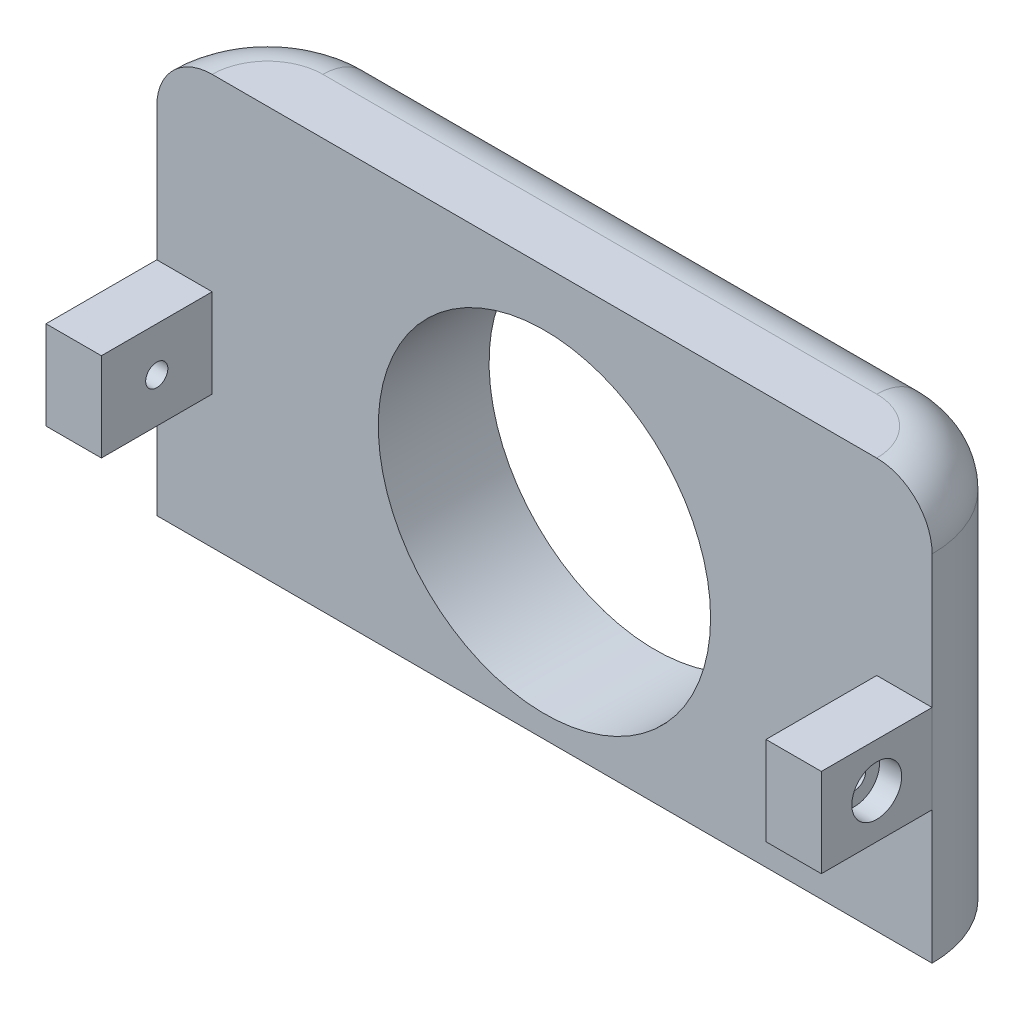
from build123d import *

# Parameters (mm, degrees)
BOSS_EXTRUDE1_DEPTH = 37
CUT_EXTRUDE1_REACH  = 53.904
FILLET1_R           = 5
CUT_EXTRUDE2_REACH  = 53.904
SKETCH4_R           = 15
SKETCH5_W           = 10
SKETCH5_H           = 8
SKETCH5_R           = 2.25
SKETCH5_R_2         = 1
BOSS_EXTRUDE2_DEPTH = 5
SKETCH5_3_R         = 2.25
SKETCH5_3_R_2       = 1
CUT_EXTRUDE3_DEPTH  = 2


with BuildPart() as part:
    # Sketch1 → Boss-Extrude1 (new body)
    with BuildSketch(Plane(origin=(0, 0, 0), x_dir=(1, 0, 0), z_dir=(0, 1, 0))):
        with BuildLine():
            Line((-25, 0), (25, 0))
            ThreePointArc((25, 0), (32.071067812, -2.928932188), (35, -10))
            Line((35, -10), (-35, -10))
            ThreePointArc((-35, -10), (-32.071067812, -2.928932188), (-25, 0))
        make_face()
    extrude(amount=BOSS_EXTRUDE1_DEPTH)

    # Sketch3 → Cut-Extrude1 (cut, up to next)
    with BuildSketch(Plane.XY.offset(10), mode=Mode.PRIVATE) as cut_extrude1_sk1:
        with BuildLine():
            Line((-30, 37), (-35, 37))
            Line((-35, 37), (-35, 32))
            ThreePointArc((-35, 32), (-33.535533906, 35.535533906), (-30, 37))
        make_face()
    cut_extrude1_tool1 = extrude(cut_extrude1_sk1.sketch, amount=-CUT_EXTRUDE1_REACH, mode=Mode.PRIVATE) & part.part
    # Sketch3 → Cut-Extrude1 (cut, up to next)
    with BuildSketch(Plane.XY.offset(10), mode=Mode.PRIVATE) as cut_extrude1_sk2:
        with BuildLine():
            Line((30, 37), (35, 37))
            Line((35, 37), (35, 32))
            ThreePointArc((35, 32), (33.535533906, 35.535533906), (30, 37))
        make_face()
    cut_extrude1_tool2 = extrude(cut_extrude1_sk2.sketch, amount=-CUT_EXTRUDE1_REACH, mode=Mode.PRIVATE) & part.part
    add(cut_extrude1_tool1.solids().sort_by_distance((-33.88316, 35.88316, 10))[0], mode=Mode.SUBTRACT)
    add(cut_extrude1_tool2.solids().sort_by_distance((33.88316, 35.88316, 10))[0], mode=Mode.SUBTRACT)

    # Fillet1
    # the kernel refuses this fillet: 5 mm, written as the material it takes off along each edge
    with BuildSketch(Plane(origin=(25, 37, 10), x_dir=(0, 0, -1), z_dir=(-1, 0, 0))) as fillet1_piece_1:
        with BuildLine():
            CenterArc((10 - FILLET1_R, FILLET1_R), FILLET1_R, 270, 90)
            Line((10 - FILLET1_R, 0), (10, 0))
            Line((10, 0), (10, FILLET1_R))
        make_face()
    revolve(axis=Axis((25, 37, 10), (0, -1, 0)), revolution_arc=101.622920284, mode=Mode.SUBTRACT)
    with BuildSketch(Plane(origin=(-25, 37, 10), x_dir=(-0.9794947331304567, 0, 0.20146976887288942), z_dir=(0.20146976887288942, 0, 0.9794947331304567))) as fillet1_piece_2:
        with BuildLine():
            CenterArc((10 - FILLET1_R, FILLET1_R), FILLET1_R, 270, 90)
            Line((10, FILLET1_R), (10, 0))
            Line((10, 0), (10 - FILLET1_R, 0))
        make_face()
    revolve(axis=Axis((-25, 37, 10), (0, -1, 0)), revolution_arc=101.622920284, mode=Mode.SUBTRACT)
    with BuildSketch(Plane(origin=(-25, 37, 0), x_dir=(0, 0, 1), z_dir=(1, 0, 0))) as fillet1_piece_3:
        with BuildLine():
            CenterArc((FILLET1_R, FILLET1_R), FILLET1_R, 180, 90)
            Line((0, FILLET1_R), (0, 0))
            Line((0, 0), (FILLET1_R, 0))
        make_face()
    extrude(amount=50, mode=Mode.SUBTRACT)

    # Sketch4 → Cut-Extrude2 (cut, up to next)
    with BuildSketch(Plane.XY.offset(10), mode=Mode.PRIVATE) as cut_extrude2_sk1:
        with Locations((0, 17)):
            Circle(SKETCH4_R)
    cut_extrude2_tool1 = extrude(cut_extrude2_sk1.sketch, amount=-CUT_EXTRUDE2_REACH, mode=Mode.PRIVATE) & part.part
    add(cut_extrude2_tool1.solids().sort_by_distance((0, 17, 10))[0], mode=Mode.SUBTRACT)

    # Sketch5 → Boss-Extrude2 (add)
    # profile 1 of 2: a face of its own
    with BuildSketch(Plane(origin=(-35, 0, 0), x_dir=(0, 0, -1), z_dir=(1, 0, 0))):
        with Locations((-15, 16)):
            Rectangle(SKETCH5_W, SKETCH5_H)
        with Locations((-15, 16)):
            Circle(SKETCH5_R, mode=Mode.SUBTRACT)
    # profile 2 of 2: a face of its own
    with BuildSketch(Plane(origin=(-35, 0, 0), x_dir=(0, 0, -1), z_dir=(1, 0, 0))):
        with Locations((-15, 16)):
            Circle(SKETCH5_R)
        with Locations((-15, 16)):
            Circle(SKETCH5_R_2, mode=Mode.SUBTRACT)
    boss_extrude2 = extrude(amount=BOSS_EXTRUDE2_DEPTH)

    # Sketch5<3> → Cut-Extrude3 (cut)
    with BuildSketch(Plane(origin=(-35, 0, 0), x_dir=(0, 0, -1), z_dir=(1, 0, 0))):
        with Locations((-15, 16)):
            Circle(SKETCH5_3_R)
        with Locations((-15, 16)):
            Circle(SKETCH5_3_R_2, mode=Mode.SUBTRACT)
    cut_extrude3 = extrude(amount=CUT_EXTRUDE3_DEPTH, mode=Mode.SUBTRACT)

    # Mirror1: Boss-Extrude2, Cut-Extrude3 across plane
    add(boss_extrude2.mirror(Plane(origin=(0, 0, 0), x_dir=(0, 0, 1), z_dir=(1, 0, 0))))
    add(cut_extrude3.mirror(Plane(origin=(0, 0, 0), x_dir=(0, 0, 1), z_dir=(1, 0, 0))), mode=Mode.SUBTRACT)


solid = part.part
